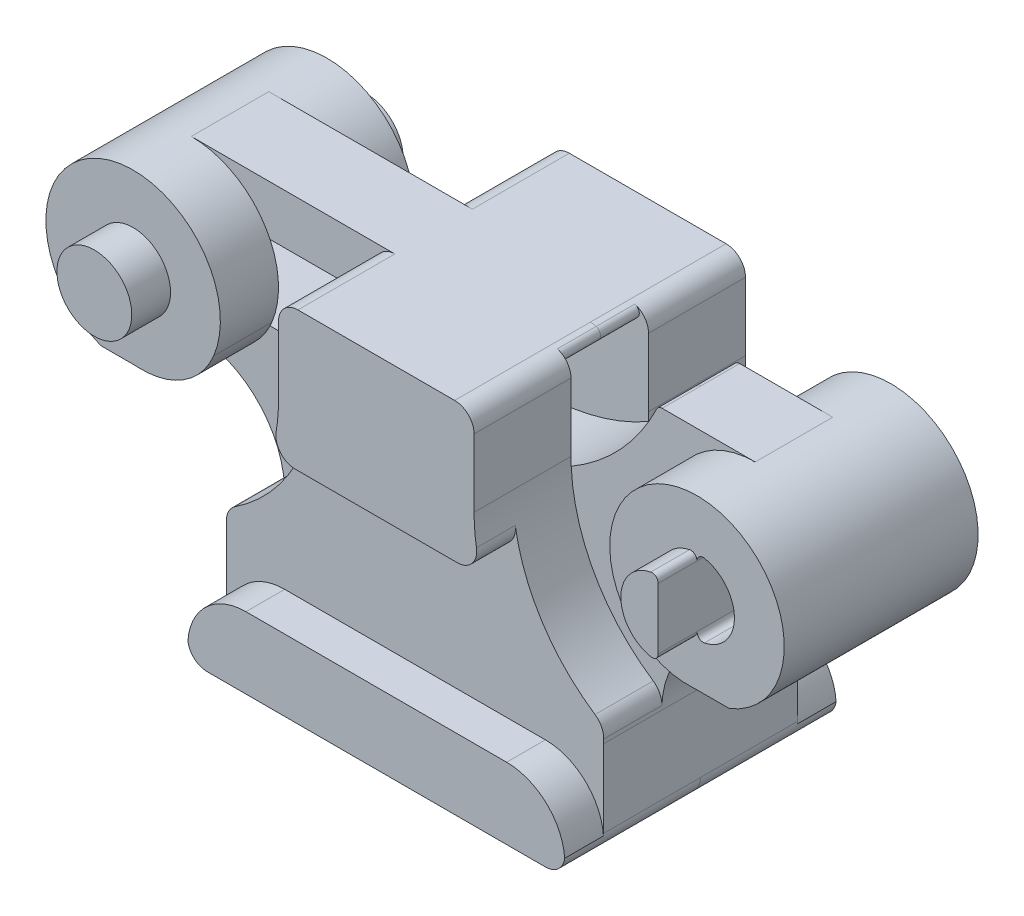
from build123d import *

# Parameters (mm, degrees)
BOSS_EXTRUDE1_DEPTH = 5.55625
CUT_EXTRUDE1_DEPTH  = 1.5875
CUT_EXTRUDE3_START  = -1.5875
SKETCH5_R           = 3.571875
SKETCH5_R_2         = 1.532001
CUT_EXTRUDE3_DEPTH  = 1.5875
CUT_EXTRUDE4_START  = -3.96875
CUT_EXTRUDE4_DEPTH  = 3.96875
CUT_EXTRUDE5_DEPTH  = 38.96960889
FILLET1_R           = 3.175
FILLET4_R           = 2.38125
FILLET2_R           = 0.79375
FILLET3_R           = 0.254
FILLET5_R           = 0.254
MIRROR1_START       = -3.96875
MIRROR1_DEPTH       = 3.96875
MIRROR1_START_2     = -5.55625
MIRROR1_2_OUTLINE_R = 1.532001
MIRROR1_2_DEPTH     = 3.96875
MIRROR1_START_3     = -1.5875
MIRROR1_3_DEPTH     = 1.5875
MIRROR1_4_DEPTH     = 2.38125


# Read off the part's stored shape, not the designer's step: Cut-Extrude4, Mirror1
with BuildPart() as part:
    # Sketch2 → Boss-Extrude1 (new body)
    with BuildSketch(Plane.XY):
        with BuildLine():
            Line((32.181610271, 11.511193514), (9.093389729, 11.511193514))
            ThreePointArc((9.093389729, 11.511193514), (5.585589436, 8.612837723), (7.770515396, 4.621443514))
            Line((7.770515396, 4.621443514), (9.093389729, 4.621443514))
            ThreePointArc((9.093389729, 4.621443514), (11.798691885, 3.500870671), (12.919264729, 0.795568514))
            Line((12.919264729, 0.795568514), (12.919264729, -3.175))
            Line((12.919264729, -3.175), (28.355735271, -3.175))
            Line((28.355735271, -3.175), (28.355735271, 0.795568514))
            ThreePointArc((28.355735271, 0.795568514), (29.476308115, 3.500870671), (32.181610271, 4.621443514))
            Line((32.181610271, 4.621443514), (33.504484604, 4.621443514))
            ThreePointArc((33.504484604, 4.621443514), (35.689410564, 8.612837723), (32.181610271, 11.511193514))
        make_face()
    extrude(amount=BOSS_EXTRUDE1_DEPTH)

    # Sketch3 → Cut-Extrude1 (cut)
    with BuildSketch(Plane.XY):
        with BuildLine():
            Line((13.576919222, 9.471319514), (5.521514729, 9.471319514))
            Line((5.521514729, 9.471319514), (5.521514729, 6.407317514))
            Line((5.521514729, 6.407317514), (20.240625, 6.407317514))
            ThreePointArc((20.240625, 6.407317514), (16.573436603, 7.21001835), (13.576919222, 9.471319514))
        make_face()
        with BuildLine():
            Line((20.240625, 9.471319514), (13.576919222, 9.471319514))
            ThreePointArc((13.576919222, 9.471319514), (16.573436603, 7.21001835), (20.240625, 6.407317514))
            ThreePointArc((20.240625, 6.407317514), (24.973649547, 7.792589705), (28.212860271, 11.511193514))
            Line((28.212860271, 11.511193514), (24.616874597, 11.511193514))
            ThreePointArc((24.616874597, 11.511193514), (22.654783573, 10.0063343), (20.240625, 9.471319514))
        make_face()
    extrude(amount=CUT_EXTRUDE1_DEPTH, mode=Mode.SUBTRACT)

    # Sketch5 → Cut-Extrude3 (cut)
    # profile 1 of 3: a face of its own
    with BuildSketch(Plane.XY.offset(5.55625).offset(CUT_EXTRUDE3_START)):
        with BuildLine():
            Line((12.919264729, 0.795568514), (12.919264729, -0.254))
            Line((12.919264729, -0.254), (28.355735271, -0.254))
            Line((28.355735271, -0.254), (28.355735271, 0.795568514))
            ThreePointArc((28.355735271, 0.795568514), (28.368258733, 1.10487348), (28.405747131, 1.412153514))
            ThreePointArc((28.405747131, 1.412153514), (26.253788464, 3.278636804), (24.947794359, 5.81025))
            Line((24.947794359, 5.81025), (16.327205641, 5.81025))
            ThreePointArc((16.327205641, 5.81025), (15.021211536, 3.278636804), (12.869252869, 1.412153514))
            ThreePointArc((12.869252869, 1.412153514), (12.906741267, 1.10487348), (12.919264729, 0.795568514))
        make_face()
    # profile 2 of 3: a face of its own
    with BuildSketch(Plane.XY.offset(5.55625).offset(CUT_EXTRUDE3_START)):
        with Locations((9.093389729, 7.939318514)):
            Circle(SKETCH5_R)
        with Locations((9.093389729, 7.939318514)):
            Circle(SKETCH5_R_2, mode=Mode.SUBTRACT)
    # profile 3 of 3: a face of its own
    with BuildSketch(Plane.XY.offset(5.55625).offset(CUT_EXTRUDE3_START)):
        with Locations((32.181610271, 7.939318514)):
            Circle(SKETCH5_R)
        with Locations((32.181610271, 7.939318514)):
            Circle(SKETCH5_R_2, mode=Mode.SUBTRACT)
    extrude(amount=CUT_EXTRUDE3_DEPTH, mode=Mode.SUBTRACT)

    # Cut-Extrude4 outline → Cut-Extrude4 (cut)
    with BuildSketch(Plane.XY.offset(5.55625).offset(CUT_EXTRUDE4_START)):
        with BuildLine():
            Line((16.634014729, 11.511193514), (9.093389729, 11.511193514))
            ThreePointArc((9.093389729, 11.511193514), (12.632233106, 8.42396123), (10.053711502, 4.49895907))
            ThreePointArc((10.053711502, 4.49895907), (11.9200404, 3.373817047), (12.869252869, 1.412153514))
            ThreePointArc((12.869252869, 1.412153514), (15.625364674, 4.171782357), (16.634014729, 7.939318514))
            Line((16.634014729, 7.939318514), (16.634014729, 11.511193514))
        make_face()
        with BuildLine():
            Line((32.181610271, 11.511193514), (24.640985271, 11.511193514))
            Line((24.640985271, 11.511193514), (24.640985271, 7.939318514))
            ThreePointArc((24.640985271, 7.939318514), (25.649635326, 4.171782357), (28.405747131, 1.412153514))
            ThreePointArc((28.405747131, 1.412153514), (29.3549596, 3.373817047), (31.221288498, 4.49895907))
            ThreePointArc((31.221288498, 4.49895907), (28.642766894, 8.42396123), (32.181610271, 11.511193514))
        make_face()
    extrude(amount=CUT_EXTRUDE4_DEPTH, mode=Mode.SUBTRACT)

    # Sketch5<4> → Cut-Extrude5 (cut, through all)
    with BuildSketch(Plane.XY.offset(5.55625)):
        with BuildLine():
            ThreePointArc((33.713611271, 7.939318514), (33.264898567, 9.02260681), (32.181610271, 9.471319514))
            Line((32.181610271, 9.471319514), (32.181610271, 6.407317514))
            ThreePointArc((32.181610271, 6.407317514), (33.264898567, 6.856030218), (33.713611271, 7.939318514))
        make_face()
    extrude(amount=-CUT_EXTRUDE5_DEPTH, mode=Mode.SUBTRACT)

    # Fillet1
    # the kernel refuses this fillet: 3.175 mm, written as the material it takes off along each edge
    with BuildSketch(Plane(origin=(10.053711502, 4.49895907, 1.5875), x_dir=(-0.98831195882872, 0.15244498035730386, 0), z_dir=(0, 0, 1))) as fillet1_piece_1:
        with BuildLine():
            CenterArc((1.088183894, -3.158922331), FILLET1_R, 95.768471476, 70.407466776)
            ThreePointArc((-1.994849121, -2.400283795), (-1.27345722, -0.97073423), (0, 0))
            ThreePointArc((0, 0), (0.384534192, -0.019373592), (0.769068383, 0))
        make_face()
    extrude(amount=10.183807799, mode=Mode.SUBTRACT)
    with BuildSketch(Plane(origin=(31.221288498, 4.49895907, 1.5875), x_dir=(-0.7489353229830101, 0.6626431030263081, 0), z_dir=(0, 0, 1))) as fillet1_piece_2:
        with BuildLine():
            CenterArc((1.733901733, -2.855962055), FILLET1_R, 64.094468917, 70.407466776)
            ThreePointArc((-0.491561687, -0.591467063), (-0.230881204, -0.308116456), (0, 0))
            ThreePointArc((0, 0), (1.56051156, 0.358917688), (3.12102312, 0))
        make_face()
    extrude(amount=10.183807799, mode=Mode.SUBTRACT)

    # Fillet4
    fillet4_edges = [part.edges().sort_by_distance(p)[0] for p in [
        (28.355735271, -0.254, 4.7625),
        (12.919264729, -0.254, 4.7625),
    ]]
    fillet(fillet4_edges, radius=FILLET4_R)

    # Fillet2
    fillet2_edges = [part.edges().sort_by_distance(p)[0] for p in [
        (24.640985271, 11.511193514, 3.571875),
        (16.634014729, 11.511193514, 3.571875),
        (28.355735271, -3.175, 2.778125),
        (12.919264729, -3.175, 2.778125),
        (16.327205641, 5.81025, 4.7625),
        (24.947794359, 5.81025, 4.7625),
        (28.405747131, 1.412153514, 2.778125),
        (12.869252869, 1.412153514, 2.778125),
    ]]
    fillet(fillet2_edges, radius=FILLET2_R)

    # Fillet3
    fillet3_edges = [part.edges().sort_by_distance(p)[0] for p in [
        (32.181610271, 6.407317514, 1.984375),
        (32.181610271, 9.471319514, 1.984375),
        (24.409605867, 11.277602756, 0.79375),
        (5.8667407, 9.471319514, 0.79375),
        (5.8667407, 6.407317514, 0.79375),
        (28.212860271, 11.511193514, 0.79375),
    ]]
    fillet(fillet3_edges, radius=FILLET3_R)

    # Fillet5
    fillet5_edges = [part.edges().sort_by_distance(p)[0] for p in [
        (32.181610271, 6.407317514, 4.7625),
        (32.181610271, 9.471319514, 4.7625),
    ]]
    fillet(fillet5_edges, radius=FILLET5_R)

    # Mirror1 outline → Mirror1 (add)
    # profile 1 of 5: a face of its own
    with BuildSketch(Plane.XY.offset(MIRROR1_START)):
        with BuildLine():
            ThreePointArc((33.504484604, 4.621443514), (33.5677662, 11.231257572), (28.88384404, 6.567083514))
            ThreePointArc((28.88384404, 6.567083514), (30.123142629, 5.100289827), (31.981367978, 4.616199685))
            ThreePointArc((31.981367978, 4.616199685), (32.0814548, 4.620132332), (32.181610271, 4.621443514))
            Line((32.181610271, 4.621443514), (33.504484604, 4.621443514))
        make_face()
        with BuildLine():
            Line((32.181610271, 6.686812803), (32.181610271, 9.191824225))
            ThreePointArc((32.181610271, 9.191824225), (32.2748409, 9.388469106), (32.486092235, 9.44075709))
            ThreePointArc((32.486092235, 9.44075709), (33.713611271, 7.939318514), (32.486092235, 6.437879938))
            ThreePointArc((32.486092235, 6.437879938), (32.274840901, 6.490167922), (32.181610271, 6.686812803))
        make_face(mode=Mode.SUBTRACT)
    # profile 2 of 5: a face of its own
    with BuildSketch(Plane.XY.offset(MIRROR1_START)):
        with BuildLine():
            Line((7.770515396, 4.621443514), (9.093389729, 4.621443514))
            ThreePointArc((9.093389729, 4.621443514), (9.1935452, 4.620132332), (9.293632022, 4.616199684))
            ThreePointArc((9.293632022, 4.616199684), (11.077123214, 5.054647904), (12.31944467, 6.407317514))
            Line((12.31944467, 6.407317514), (6.297232554, 6.407317514))
            ThreePointArc((6.297232554, 6.407317514), (6.074471756, 6.275356961), (6.083172675, 6.016590165))
            ThreePointArc((6.083172675, 6.016590165), (6.817312229, 5.186544962), (7.770515396, 4.621443514))
        make_face()
    # profile 3 of 5: a face of its own
    with BuildSketch(Plane.XY.offset(MIRROR1_START)):
        with BuildLine():
            ThreePointArc((13.268979766, 1.6603478), (13.000797679, 1.358812007), (12.915538612, 0.964380318))
            ThreePointArc((12.915538612, 0.964380318), (12.918333087, 0.879994975), (12.919264729, 0.795568514))
            Line((12.919264729, 0.795568514), (12.919264729, -2.38125))
            ThreePointArc((12.919264729, -2.38125), (13.151748721, -2.942516008), (13.713014729, -3.175))
            Line((13.713014729, -3.175), (27.561985271, -3.175))
            ThreePointArc((27.561985271, -3.175), (28.123251279, -2.942516008), (28.355735271, -2.38125))
            Line((28.355735271, -2.38125), (28.355735271, 0.795568514))
            ThreePointArc((28.355735271, 0.795568514), (28.356666913, 0.879994975), (28.359461387, 0.964380318))
            ThreePointArc((28.359461387, 0.964380318), (28.274202321, 1.358812007), (28.006020234, 1.6603478))
            ThreePointArc((28.006020234, 1.6603478), (25.618483881, 4.226314694), (24.648875364, 7.59445591))
            ThreePointArc((24.648875364, 7.59445591), (22.523275261, 6.709296274), (20.240625, 6.407317514))
            Line((20.240625, 6.407317514), (16.476749284, 6.407317514))
            ThreePointArc((16.476749284, 6.407317514), (15.341250105, 3.717320634), (13.268979766, 1.6603478))
        make_face()
    # profile 4 of 5: a face of its own
    with BuildSketch(Plane.XY.offset(MIRROR1_START)):
        with BuildLine():
            ThreePointArc((12.320038756, 9.471319514), (9.31672281, 11.504204676), (6.083172675, 9.862046864))
            ThreePointArc((6.083172675, 9.862046864), (6.074471756, 9.603280068), (6.297232554, 9.471319514))
            Line((6.297232554, 9.471319514), (12.320038756, 9.471319514))
        make_face()
    # profile 5 of 5: a face of its own
    with BuildSketch(Plane.XY.offset(MIRROR1_START)):
        with BuildLine():
            Line((16.634014729, 10.717443514), (16.634014729, 9.471319514))
            Line((16.634014729, 9.471319514), (20.240625, 9.471319514))
            ThreePointArc((20.240625, 9.471319514), (22.363705374, 9.880367157), (24.182828792, 11.048947593))
            ThreePointArc((24.182828792, 11.048947593), (24.254916787, 11.290688464), (24.083060366, 11.475352208))
            ThreePointArc((24.083060366, 11.475352208), (23.966501858, 11.502182034), (23.847235271, 11.511193514))
            Line((23.847235271, 11.511193514), (17.427764729, 11.511193514))
            ThreePointArc((17.427764729, 11.511193514), (16.866498721, 11.278709522), (16.634014729, 10.717443514))
        make_face()
    extrude(amount=MIRROR1_DEPTH)

    # Mirror1 2 outline → Mirror1 2 (add)
    with BuildSketch(Plane.XY.offset(MIRROR1_START_2)):
        with BuildLine():
            ThreePointArc((31.877128308, 9.44075709), (30.649609271, 7.939318514), (31.877128308, 6.437879938))
            ThreePointArc((31.877128308, 6.437879938), (32.088379642, 6.490167922), (32.181610271, 6.686812803))
            Line((32.181610271, 6.686812803), (32.181610271, 9.191824225))
            ThreePointArc((32.181610271, 9.191824225), (32.088379643, 9.388469107), (31.877128308, 9.44075709))
        make_face()
        with Locations((9.093389729, 7.939318514)):
            Circle(MIRROR1_2_OUTLINE_R)
        with BuildLine():
            ThreePointArc((16.536602091, 6.731173192), (16.715539288, 6.089658022), (17.320098129, 5.81025))
            Line((17.320098129, 5.81025), (23.954901871, 5.81025))
            ThreePointArc((23.954901871, 5.81025), (24.559460712, 6.089658022), (24.738397909, 6.731173192))
            ThreePointArc((24.738397909, 6.731173192), (24.665377884, 7.333285441), (24.640985271, 7.939318514))
            Line((24.640985271, 7.939318514), (24.640985271, 10.717443514))
            ThreePointArc((24.640985271, 10.717443514), (24.408501279, 11.278709522), (23.847235271, 11.511193514))
            Line((23.847235271, 11.511193514), (17.427764729, 11.511193514))
            ThreePointArc((17.427764729, 11.511193514), (16.866498721, 11.278709522), (16.634014729, 10.717443514))
            Line((16.634014729, 10.717443514), (16.634014729, 7.939318514))
            ThreePointArc((16.634014729, 7.939318514), (16.609622116, 7.333285441), (16.536602091, 6.731173192))
        make_face()
        with BuildLine():
            ThreePointArc((15.300514729, -0.254), (13.674670512, -0.895427553), (12.924720282, -2.47415279))
            ThreePointArc((12.924720282, -2.47415279), (13.185616647, -2.974453444), (13.713014729, -3.175))
            Line((13.713014729, -3.175), (27.561985271, -3.175))
            ThreePointArc((27.561985271, -3.175), (28.089383353, -2.974453444), (28.350279717, -2.47415279))
            ThreePointArc((28.350279717, -2.47415279), (27.600329488, -0.895427553), (25.974485271, -0.254))
            Line((25.974485271, -0.254), (15.300514729, -0.254))
        make_face()
    extrude(amount=MIRROR1_2_DEPTH)

    # Mirror1 3 outline → Mirror1 3 (add)
    with BuildSketch(Plane.XY.offset(MIRROR1_START_3)):
        with BuildLine():
            ThreePointArc((12.31944467, 6.407317514), (11.077123214, 5.054647904), (9.293632022, 4.616199685))
            ThreePointArc((9.293632022, 4.616199685), (11.809794313, 3.489722491), (12.915538613, 0.964380318))
            ThreePointArc((12.915538613, 0.964380318), (13.000797679, 1.358812007), (13.268979766, 1.6603478))
            ThreePointArc((13.268979766, 1.6603478), (15.341250105, 3.717320634), (16.476749284, 6.407317514))
            Line((16.476749284, 6.407317514), (12.31944467, 6.407317514))
        make_face()
        with BuildLine():
            ThreePointArc((9.093389729, 11.511193514), (11.002077097, 10.958458051), (12.320038756, 9.471319514))
            Line((12.320038756, 9.471319514), (16.634014729, 9.471319514))
            Line((16.634014729, 9.471319514), (16.634014729, 10.717443514))
            ThreePointArc((16.634014729, 10.717443514), (16.866498721, 11.278709522), (17.427764729, 11.511193514))
            Line((17.427764729, 11.511193514), (9.093389729, 11.511193514))
        make_face()
        with BuildLine():
            ThreePointArc((28.145128939, 11.367664925), (26.679588907, 9.219215672), (24.648875364, 7.59445591))
            ThreePointArc((24.648875364, 7.59445591), (25.618483881, 4.226314694), (28.006020234, 1.6603478))
            ThreePointArc((28.006020234, 1.6603478), (28.274202321, 1.358812007), (28.359461388, 0.964380318))
            ThreePointArc((28.359461388, 0.964380318), (29.465205687, 3.489722491), (31.981367978, 4.616199684))
            ThreePointArc((31.981367978, 4.616199684), (30.123142629, 5.100289827), (28.88384404, 6.567083514))
            ThreePointArc((28.88384404, 6.567083514), (29.21010031, 9.921342621), (32.181610271, 11.511193514))
            Line((32.181610271, 11.511193514), (28.373847254, 11.511193514))
            ThreePointArc((28.373847254, 11.511193514), (28.238835659, 11.472339672), (28.145128939, 11.367664925))
        make_face()
    extrude(amount=MIRROR1_3_DEPTH)

    # Mirror1 4 outline → Mirror1 4 (add)
    with BuildSketch(Plane.XY.offset(MIRROR1_START)):
        with BuildLine():
            Line((9.093389729, 6.407317514), (12.31944467, 6.407317514))
            ThreePointArc((12.31944467, 6.407317514), (12.356402042, 6.486706002), (12.39115596, 6.567083514))
            ThreePointArc((12.39115596, 6.567083514), (12.664194302, 8.026758252), (12.320038756, 9.471319514))
            Line((12.320038756, 9.471319514), (9.093389729, 9.471319514))
            ThreePointArc((9.093389729, 9.471319514), (10.625390729, 7.939318514), (9.093389729, 6.407317514))
        make_face()
        with BuildLine():
            ThreePointArc((6.083172675, 9.862046864), (5.521514728, 7.939318514), (6.083172675, 6.016590165))
            ThreePointArc((6.083172675, 6.016590165), (6.074471756, 6.275356961), (6.297232554, 6.407317514))
            Line((6.297232554, 6.407317514), (9.093389729, 6.407317514))
            ThreePointArc((9.093389729, 6.407317514), (7.561388729, 7.939318514), (9.093389729, 9.471319514))
            Line((9.093389729, 9.471319514), (6.297232554, 9.471319514))
            ThreePointArc((6.297232554, 9.471319514), (6.074471756, 9.603280068), (6.083172675, 9.862046864))
        make_face()
        with BuildLine():
            ThreePointArc((16.536602091, 6.731173192), (16.508443965, 6.568918552), (16.476749284, 6.407317514))
            Line((16.476749284, 6.407317514), (16.55110199, 6.407317514))
            ThreePointArc((16.55110199, 6.407317514), (16.527142509, 6.568497222), (16.536602091, 6.731173192))
        make_face()
    extrude(amount=MIRROR1_4_DEPTH)


solid = part.part
